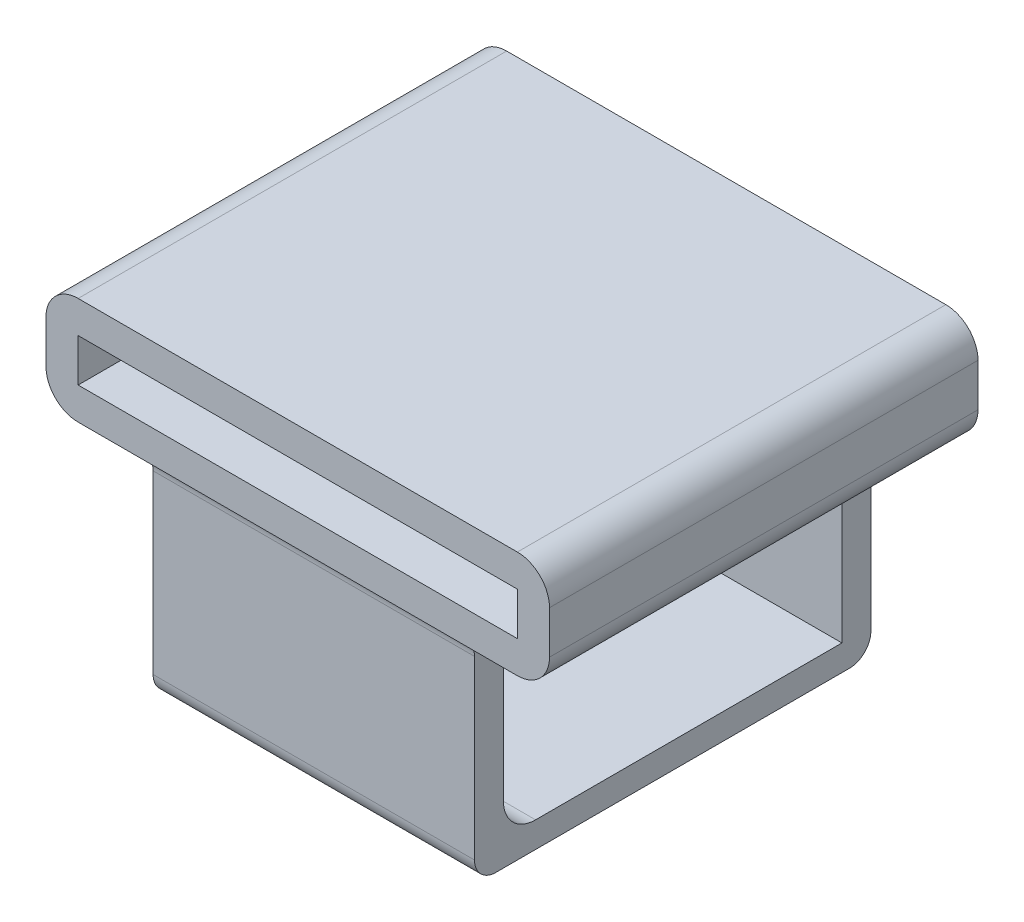
from build123d import *

# Parameters (mm, degrees)
CROQUIS1_W              = 23.5
CROQUIS1_H              = 5
CROQUIS1_W_2            = 20.5
CROQUIS1_H_2            = 2
SALIENTE_EXTRUIR1_DEPTH = 20
CROQUIS5_W              = 15
CROQUIS5_H              = 18.5
SALIENTE_EXTRUIR3_DEPTH = 10.2
CROQUIS6_W              = 15.8
CROQUIS6_H              = 8.2
CORTAR_EXTRUIR2_DEPTH   = 15
REDONDEO3_R             = 1.5
CORTAR_EXTRUIR3_DEPTH   = 3
REDONDEO4_R             = 1
REDONDEO5_R             = 1.5


with BuildPart() as part:
    # Croquis1 → Saliente-Extruir1 (new body)
    with BuildSketch(Plane.XY):
        with Locations((-10.25, 1)):
            Rectangle(CROQUIS1_W, CROQUIS1_H)
        with Locations((-10.25, 1)):
            Rectangle(CROQUIS1_W_2, CROQUIS1_H_2, mode=Mode.SUBTRACT)
    extrude(amount=SALIENTE_EXTRUIR1_DEPTH)

    # Croquis5 → Saliente-Extruir3 (add)
    with BuildSketch(Plane.XZ.offset(1.5)):
        with Locations((-10.25, 10)):
            Rectangle(CROQUIS5_W, CROQUIS5_H)
    extrude(amount=SALIENTE_EXTRUIR3_DEPTH)

    # Croquis6 → Cortar-Extruir2 (cut)
    with BuildSketch(Plane.ZY.offset(17.75)):
        with Locations((10, -6.4)):
            Rectangle(CROQUIS6_W, CROQUIS6_H)
    extrude(amount=-CORTAR_EXTRUIR2_DEPTH, mode=Mode.SUBTRACT)

    # Redondeo3
    redondeo3_edges = [part.edges().sort_by_distance(p)[0] for p in [
        (-10.25, -2.3, 17.9),
        (-10.25, -10.5, 17.9),
    ]]
    fillet(redondeo3_edges, radius=REDONDEO3_R)

    # Croquis7 → Cortar-Extruir3 (cut)
    with BuildSketch(Plane.ZY.offset(17.75)):
        with BuildLine():
            Line((17.9, -11), (2.1, -11))
            ThreePointArc((2.1, -11), (1.746446609, -10.853553391), (1.6, -10.5))
            Line((1.6, -10.5), (1.6, -2.3))
            ThreePointArc((1.6, -2.3), (1.746446609, -1.946446609), (2.1, -1.8))
            Line((2.1, -1.8), (17.9, -1.8))
            ThreePointArc((17.9, -1.8), (18.253553391, -1.946446609), (18.4, -2.3))
            Line((18.4, -2.3), (18.4, -10.5))
            ThreePointArc((18.4, -10.5), (18.253553391, -10.853553391), (17.9, -11))
        make_face()
    extrude(amount=-CORTAR_EXTRUIR3_DEPTH, mode=Mode.SUBTRACT)

    # Redondeo4
    # the kernel refuses this fillet: 1 mm, written as the material it adds along each edge
    with BuildSketch(Plane(origin=(-2.75, -1.5, 0.75), x_dir=(0, 0, -1), z_dir=(-1, 0, 0))) as redondeo4_piece_1:
        with BuildLine():
            CenterArc((1, 0.968245837), REDONDEO4_R, 180, 75.522487814)
            Line((0, 0.968245837), (0, 0))
            Line((0, 0), (0.75, 0))
        make_face()
    extrude(amount=15)
    with BuildSketch(Plane(origin=(-17.75, -1.5, 19.25), x_dir=(0, -1, 0), z_dir=(1, 0, 0))) as redondeo4_piece_2:
        with BuildLine():
            CenterArc((0.968245837, -1), REDONDEO4_R, 90, 75.522487814)
            Line((0, -0.75), (0, 0))
            Line((0, 0), (0.968245837, 0))
        make_face()
    extrude(amount=15)
    # the kernel refuses this fillet: 1 mm, written as the material it takes off along each edge
    with BuildSketch(Plane(origin=(-0.25, -11.7, 0.75), x_dir=(0, 1, 0), z_dir=(-1, 0, 0))) as redondeo4_2_piece_1:
        with BuildLine():
            CenterArc((REDONDEO4_R, -REDONDEO4_R), REDONDEO4_R, 90, 90)
            Line((0, -REDONDEO4_R), (0, 0))
            Line((0, 0), (REDONDEO4_R, 0))
        make_face()
    extrude(amount=20, mode=Mode.SUBTRACT)
    with BuildSketch(Plane(origin=(-20.25, -11.7, 19.25), x_dir=(0, 0, -1), z_dir=(1, 0, 0))) as redondeo4_2_piece_2:
        with BuildLine():
            CenterArc((REDONDEO4_R, REDONDEO4_R), REDONDEO4_R, 180, 90)
            Line((0, REDONDEO4_R), (0, 0))
            Line((0, 0), (REDONDEO4_R, 0))
        make_face()
    extrude(amount=20, mode=Mode.SUBTRACT)

    # Redondeo5
    redondeo5_edges = [part.edges().sort_by_distance(p)[0] for p in [
        (-22, -1.5, 10),
        (-22, 3.5, 10),
        (1.5, 3.5, 10),
        (1.5, -1.5, 10),
    ]]
    fillet(redondeo5_edges, radius=REDONDEO5_R)


solid = part.part
